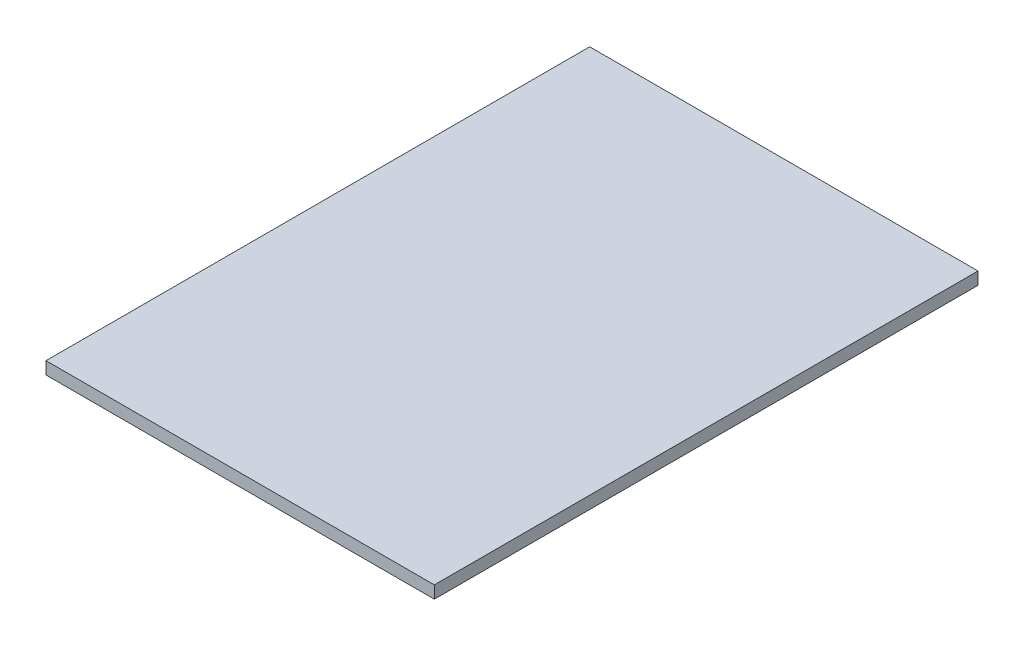
from build123d import *

# Parameters (mm, degrees)
SKETCH1_W           = 50
SKETCH1_H           = 70
BOSS_EXTRUDE1_DEPTH = 1.6


with BuildPart() as part:
    # Sketch1 → Boss-Extrude1 (new body)
    with BuildSketch(Plane(origin=(0, 0, 0), x_dir=(1, 0, 0), z_dir=(0, 1, 0))):
        with Locations((-5, -14.824561404)):
            Rectangle(SKETCH1_W, SKETCH1_H)
    extrude(amount=BOSS_EXTRUDE1_DEPTH)


solid = part.part
